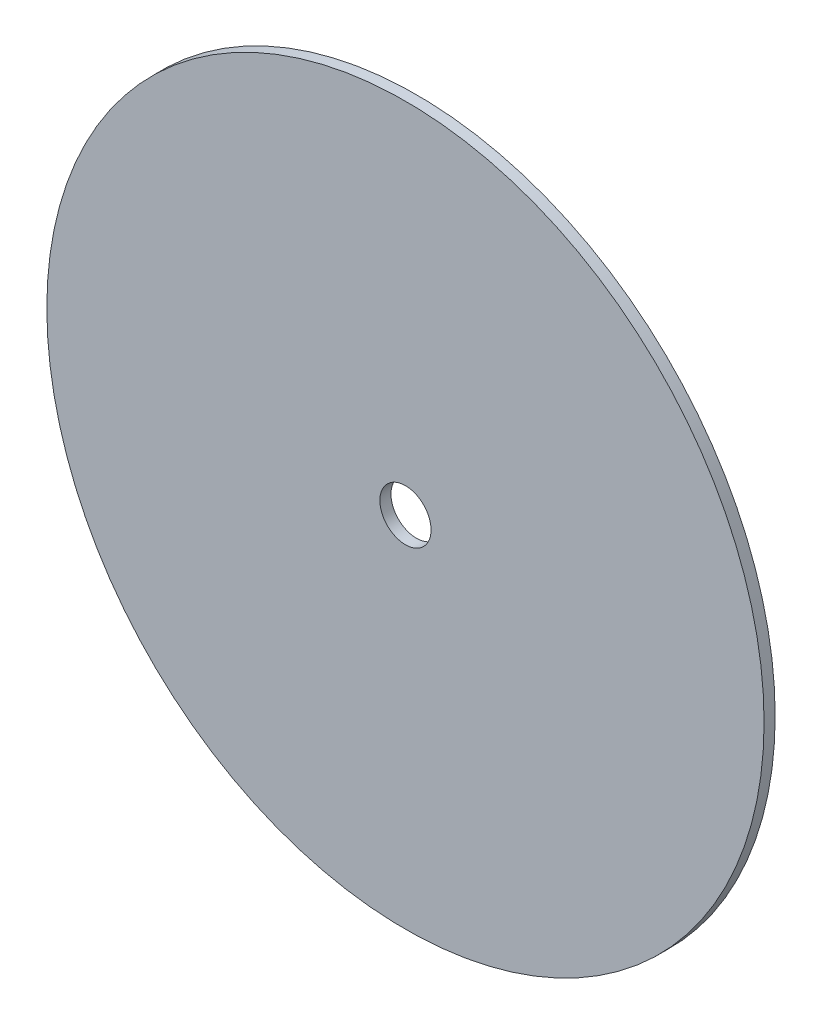
from build123d import *

# Parameters (mm, degrees)
SKETCH11_R         = 23.819627694
SKETCH11_R_2       = 1.699231601
BASE_FLANGE2_DEPTH = 0.7366


# Sheet-metal steps are written as plain solids
with BuildPart() as part:
    # Sketch11 → Base-Flange2 (new body)
    with BuildSketch(Plane.XY):
        Circle(SKETCH11_R)
        Circle(SKETCH11_R_2, mode=Mode.SUBTRACT)
    extrude(amount=-BASE_FLANGE2_DEPTH)


solid = part.part
